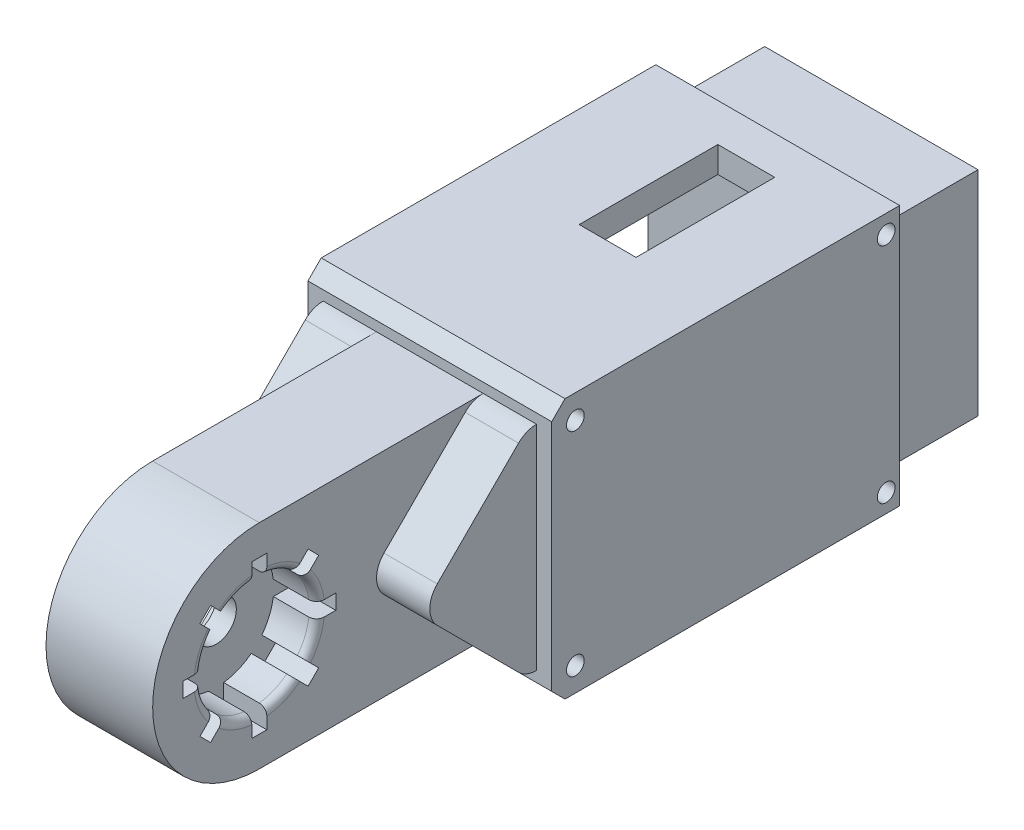
from build123d import *

# Parameters (mm, degrees)
SKETCH2_W                = 42
SKETCH2_H                = 42
BOSS_EXTRUDE1_DEPTH      = 89
SKETCH3_W                = 21
SKETCH3_H                = 42
BOSS_EXTRUDE2_DEPTH      = 42
BOSS_EXTRUDE3_DEPTH      = 21
SKETCH9_R                = 11.35
CUT_EXTRUDE2_DEPTH       = 8.5
CUT_EXTRUDE3_START       = -8.5
SKETCH11_R               = 11.35
CUT_EXTRUDE3_DEPTH       = 8.5
SKETCH12_R               = 3.975
CUT_EXTRUDE4_DEPTH       = 156.157984003
BOSS_EXTRUDE4_DEPTH      = 10.5
BOSS_EXTRUDE4_DEPTH_BACK = 31.5
FILLET1_R                = 5
FILLET2_R                = 5
FILLET3_R                = 5
FILLET4_R                = 5
FILLET5_R                = 5
FILLET6_R                = 5
FILLET7_R                = 1.5
FILLET8_R                = 1.5
SKETCH21_W               = 2.95860585
SKETCH21_H               = 4.417
CUT_EXTRUDE5_DEPTH       = 8.5
CIRPATTERN2_COUNT        = 8
MIRROR1_COPY_1_SKETCH_W  = 2.95860585
MIRROR1_COPY_1_SKETCH_H  = 4.417
MIRROR1_COPY_1_DEPTH     = 8.5
MIRROR1_COPY_2_SKETCH_W  = 2.95860585
MIRROR1_COPY_2_SKETCH_H  = 4.417
MIRROR1_COPY_2_DEPTH     = 8.5
MIRROR1_COPY_3_SKETCH_W  = 2.95860585
MIRROR1_COPY_3_SKETCH_H  = 4.417
MIRROR1_COPY_3_DEPTH     = 8.5
MIRROR1_COPY_4_SKETCH_W  = 2.95860585
MIRROR1_COPY_4_SKETCH_H  = 4.417
MIRROR1_COPY_4_DEPTH     = 8.5
MIRROR1_COPY_5_SKETCH_W  = 2.95860585
MIRROR1_COPY_5_SKETCH_H  = 4.417
MIRROR1_COPY_5_DEPTH     = 8.5
MIRROR1_COPY_6_SKETCH_W  = 2.95860585
MIRROR1_COPY_6_SKETCH_H  = 4.417
MIRROR1_COPY_6_DEPTH     = 8.5
MIRROR1_COPY_7_SKETCH_W  = 2.95860585
MIRROR1_COPY_7_SKETCH_H  = 4.417
MIRROR1_COPY_7_DEPTH     = 8.5
MIRROR1_COPY_8_SKETCH_W  = 2.95860585
MIRROR1_COPY_8_SKETCH_H  = 4.417
MIRROR1_COPY_8_DEPTH     = 8.5
SKETCH24_W               = 86.928932188
SKETCH24_H               = 4.545220174
SKETCH24_H_2             = 4.689106432
BOSS_EXTRUDE6_DEPTH      = 42
SKETCH25_W               = 68.5
SKETCH25_H               = 51.234326606
BOSS_EXTRUDE7_DEPTH      = 3
SKETCH28_W               = 68.5
SKETCH28_H               = 51.234326606
BOSS_EXTRUDE8_DEPTH      = 3
SKETCH30_W               = 62
SKETCH30_H               = 41.004326606
CUT_EXTRUDE6_DEPTH       = 45
SKETCH31_W               = 18.428932188
SKETCH31_H               = 4.615
CUT_EXTRUDE7_DEPTH       = 161.589321529
CHAMFER1_SIZE            = 1.5
SKETCH32_W               = 30
SKETCH32_H               = 30
CUT_EXTRUDE8_DEPTH       = 16.8
SKETCH33_R               = 5
CUT_EXTRUDE9_DEPTH       = 16.8
CUT_EXTRUDE10_DEPTH      = 162.455660134
CHAMFER2_SIZE            = 6
CHAMFER3_SIZE            = 6
CHAMFER4_SIZE            = 6
CHAMFER5_SIZE            = 6
SKETCH35_R               = 1.75
CUT_EXTRUDE11_DEPTH      = 162.455660134
SKETCH38_W               = 11.2
SKETCH38_H               = 27.3
CUT_EXTRUDE12_DEPTH      = 163.188027372


with BuildPart() as part:
    # Sketch2 → Boss-Extrude1 (new body)
    with BuildSketch(Plane.XY):
        Rectangle(SKETCH2_W, SKETCH2_H)
    extrude(amount=BOSS_EXTRUDE1_DEPTH)

    # Sketch3 → Boss-Extrude2 (add)
    with BuildSketch(Plane.XY.offset(89)):
        Rectangle(SKETCH3_W, SKETCH3_H)
    extrude(amount=BOSS_EXTRUDE2_DEPTH)

    # Sketch8 → Boss-Extrude3 (add)
    with BuildSketch(Plane.ZY.offset(10.5)):
        with BuildLine():
            Line((131, 21), (131, -21))
            ThreePointArc((131, -21), (152, 0), (131, 21))
        make_face()
    extrude(amount=-BOSS_EXTRUDE3_DEPTH)

    # Sketch9 → Cut-Extrude2 (cut)
    with BuildSketch(Plane.ZY.offset(10.5)):
        with Locations((131, 0)):
            Circle(SKETCH9_R)
    extrude(amount=-CUT_EXTRUDE2_DEPTH, mode=Mode.SUBTRACT)

    # Sketch11 → Cut-Extrude3 (cut)
    with BuildSketch(Plane(origin=(10.5, 0, 0), x_dir=(0, 0, -1), z_dir=(1, 0, 0)).offset(CUT_EXTRUDE3_START)):
        with Locations((-131, 0)):
            Circle(SKETCH11_R)
    extrude(amount=CUT_EXTRUDE3_DEPTH, mode=Mode.SUBTRACT)

    # Sketch12 → Cut-Extrude4 (cut, through all)
    with BuildSketch(Plane.ZY.offset(2)):
        with Locations((131, 0)):
            Circle(SKETCH12_R)
    extrude(amount=-CUT_EXTRUDE4_DEPTH, mode=Mode.SUBTRACT)

    # Sketch20 → Boss-Extrude4 (add, two sides: drawn at the far end of the back side and taken through both)
    with BuildSketch(Plane.ZY.offset(10.5).offset(-BOSS_EXTRUDE4_DEPTH_BACK)):
        Polygon((89, -21), (110, 0), (89, 21), align=None)
    extrude(amount=BOSS_EXTRUDE4_DEPTH + BOSS_EXTRUDE4_DEPTH_BACK)

    # Fillet1
    fillet1_edges = [part.edges().sort_by_distance(p)[0] for p in [
        (15.75, 0, 110),
    ]]
    fillet(fillet1_edges, radius=FILLET1_R)

    # Fillet2
    fillet2_edges = [part.edges().sort_by_distance(p)[0] for p in [
        (-15.75, 0, 110),
    ]]
    fillet(fillet2_edges, radius=FILLET2_R)

    # Fillet3
    fillet3_edges = [part.edges().sort_by_distance(p)[0] for p in [
        (-15.75, -21, 89),
    ]]
    fillet(fillet3_edges, radius=FILLET3_R)

    # Fillet4
    fillet4_edges = [part.edges().sort_by_distance(p)[0] for p in [
        (-15.75, 21, 89),
    ]]
    fillet(fillet4_edges, radius=FILLET4_R)

    # Fillet5
    fillet5_edges = [part.edges().sort_by_distance(p)[0] for p in [
        (15.75, -21, 89),
    ]]
    fillet(fillet5_edges, radius=FILLET5_R)

    # Fillet6
    fillet6_edges = [part.edges().sort_by_distance(p)[0] for p in [
        (15.75, 21, 89),
    ]]
    fillet(fillet6_edges, radius=FILLET6_R)

    # Fillet7
    fillet7_edges = [part.edges().sort_by_distance(p)[0] for p in [
        (-10.5, 0, 119.65),
    ]]
    fillet(fillet7_edges, radius=FILLET7_R)

    # Fillet8
    fillet8_edges = [part.edges().sort_by_distance(p)[0] for p in [
        (10.5, 0, 142.35),
    ]]
    fillet(fillet8_edges, radius=FILLET8_R)

    # Sketch21 → Cut-Extrude5 (cut)
    with BuildSketch(Plane.ZY.offset(10.5)):
        with Locations((131, 12.85)):
            Rectangle(SKETCH21_W, SKETCH21_H)
    cut_extrude5 = extrude(amount=-CUT_EXTRUDE5_DEPTH, mode=Mode.SUBTRACT)

    # CirPattern2: Cut-Extrude5 ×8 about axis
    cirpattern2_axis = Axis((-9, 0, 131), (-1, 0, 0))
    for i in range(1, CIRPATTERN2_COUNT):
        add(cut_extrude5.rotate(cirpattern2_axis, i * 360 / CIRPATTERN2_COUNT), mode=Mode.SUBTRACT)

    # Mirror1 copy 1 sketch → Mirror1 copy 1 (cut)
    with BuildSketch(Plane(origin=(10.5, -92.630988335, 38.369011665), x_dir=(0, 0.7071067811865475, 0.7071067811865476), z_dir=(1, 0, 0))):
        with Locations((131, -12.85)):
            Rectangle(MIRROR1_COPY_1_SKETCH_W, MIRROR1_COPY_1_SKETCH_H)
    extrude(amount=-MIRROR1_COPY_1_DEPTH, mode=Mode.SUBTRACT)

    # Mirror1 copy 2 sketch → Mirror1 copy 2 (cut)
    with BuildSketch(Plane(origin=(10.5, -131, 131), x_dir=(0, 1, 0), z_dir=(1, 0, 0))):
        with Locations((131, -12.85)):
            Rectangle(MIRROR1_COPY_2_SKETCH_W, MIRROR1_COPY_2_SKETCH_H)
    extrude(amount=-MIRROR1_COPY_2_DEPTH, mode=Mode.SUBTRACT)

    # Mirror1 copy 3 sketch → Mirror1 copy 3 (cut)
    with BuildSketch(Plane(origin=(10.5, -92.630988335, 223.630988335), x_dir=(0, 0.7071067811865476, -0.7071067811865475), z_dir=(1, 0, 0))):
        with Locations((131, -12.85)):
            Rectangle(MIRROR1_COPY_3_SKETCH_W, MIRROR1_COPY_3_SKETCH_H)
    extrude(amount=-MIRROR1_COPY_3_DEPTH, mode=Mode.SUBTRACT)

    # Mirror1 copy 4 sketch → Mirror1 copy 4 (cut)
    with BuildSketch(Plane(origin=(10.5, 0, 262), x_dir=(0, 0, -1), z_dir=(1, 0, 0))):
        with Locations((131, -12.85)):
            Rectangle(MIRROR1_COPY_4_SKETCH_W, MIRROR1_COPY_4_SKETCH_H)
    extrude(amount=-MIRROR1_COPY_4_DEPTH, mode=Mode.SUBTRACT)

    # Mirror1 copy 5 sketch → Mirror1 copy 5 (cut)
    with BuildSketch(Plane(origin=(10.5, 92.630988335, 223.630988335), x_dir=(0, -0.7071067811865475, -0.7071067811865477), z_dir=(1, 0, 0))):
        with Locations((131, -12.85)):
            Rectangle(MIRROR1_COPY_5_SKETCH_W, MIRROR1_COPY_5_SKETCH_H)
    extrude(amount=-MIRROR1_COPY_5_DEPTH, mode=Mode.SUBTRACT)

    # Mirror1 copy 6 sketch → Mirror1 copy 6 (cut)
    with BuildSketch(Plane(origin=(10.5, 131, 131), x_dir=(0, -1, 0), z_dir=(1, 0, 0))):
        with Locations((131, -12.85)):
            Rectangle(MIRROR1_COPY_6_SKETCH_W, MIRROR1_COPY_6_SKETCH_H)
    extrude(amount=-MIRROR1_COPY_6_DEPTH, mode=Mode.SUBTRACT)

    # Mirror1 copy 7 sketch → Mirror1 copy 7 (cut)
    with BuildSketch(Plane(origin=(10.5, 92.630988335, 38.369011665), x_dir=(0, -0.7071067811865477, 0.7071067811865474), z_dir=(1, 0, 0))):
        with Locations((131, -12.85)):
            Rectangle(MIRROR1_COPY_7_SKETCH_W, MIRROR1_COPY_7_SKETCH_H)
    extrude(amount=-MIRROR1_COPY_7_DEPTH, mode=Mode.SUBTRACT)

    # Mirror1 copy 8 sketch → Mirror1 copy 8 (cut)
    with BuildSketch(Plane(origin=(10.5, 0, 0), x_dir=(0, 0, 1), z_dir=(1, 0, 0))):
        with Locations((131, -12.85)):
            Rectangle(MIRROR1_COPY_8_SKETCH_W, MIRROR1_COPY_8_SKETCH_H)
    extrude(amount=-MIRROR1_COPY_8_DEPTH, mode=Mode.SUBTRACT)

    # Sketch24 → Boss-Extrude6 (add)
    with BuildSketch(Plane(origin=(21, 0, 0), x_dir=(0, 0, -1), z_dir=(1, 0, 0))):
        with Locations((-43.464466094, 23.272610087)):
            Rectangle(SKETCH24_W, SKETCH24_H)
        with Locations((-43.464466094, -23.344553216)):
            Rectangle(SKETCH24_W, SKETCH24_H_2)
    extrude(amount=-BOSS_EXTRUDE6_DEPTH)

    # Sketch25 → Boss-Extrude7 (add)
    with BuildSketch(Plane(origin=(21, 0, 0), x_dir=(0, 0, -1), z_dir=(1, 0, 0))):
        with Locations((-52.678932188, -0.071943129)):
            Rectangle(SKETCH25_W, SKETCH25_H)
    extrude(amount=BOSS_EXTRUDE7_DEPTH)

    # Sketch28 → Boss-Extrude8 (add)
    with BuildSketch(Plane.ZY.offset(21)):
        with Locations((52.678932188, -0.071943129)):
            Rectangle(SKETCH28_W, SKETCH28_H)
    extrude(amount=BOSS_EXTRUDE8_DEPTH)

    # Sketch30 → Cut-Extrude6 (cut)
    with BuildSketch(Plane.ZY.offset(24)):
        with Locations((50.928932188, -0.071943129)):
            Rectangle(SKETCH30_W, SKETCH30_H)
    extrude(amount=-CUT_EXTRUDE6_DEPTH, mode=Mode.SUBTRACT)

    # Sketch31 → Cut-Extrude7 (cut, through all)
    with BuildSketch(Plane(origin=(21, 0, 0), x_dir=(0, 0, -1), z_dir=(1, 0, 0))):
        with Locations((-9.214466094, -23.381606432)):
            Rectangle(SKETCH31_W, SKETCH31_H)
        with Locations((-9.214466094, 23.237720174)):
            Rectangle(SKETCH31_W, SKETCH31_H)
    extrude(amount=-CUT_EXTRUDE7_DEPTH, mode=Mode.SUBTRACT)

    # Chamfer1
    chamfer1_edges = [part.edges().sort_by_distance(p)[0] for p in [
        (0, 20.930220174, 18.428932188),
        (21, -0.071943129, 18.428932188),
        (0, -21.074106432, 18.428932188),
        (-21, -0.071943129, 18.428932188),
    ]]
    chamfer(chamfer1_edges, length=CHAMFER1_SIZE)

    # Sketch32 → Cut-Extrude8 (cut)
    with BuildSketch(Plane(origin=(0, 0, 0), x_dir=(-1, 0, 0), z_dir=(0, 0, -1))):
        Rectangle(SKETCH32_W, SKETCH32_H)
    extrude(amount=-CUT_EXTRUDE8_DEPTH, mode=Mode.SUBTRACT)

    # Sketch33 → Cut-Extrude9 (cut)
    with BuildSketch(Plane.XY.offset(19.928932188)):
        Circle(SKETCH33_R)
    extrude(amount=-CUT_EXTRUDE9_DEPTH, mode=Mode.SUBTRACT)

    # Sketch34 → Cut-Extrude10 (cut, through all)
    with BuildSketch(Plane.ZY.offset(24)):
        Polygon((88.330412389, -21.669587611), (88.330412389, -28.222069099), (81.777930901, -28.222069099), align=None)
        Polygon((88.330412389, 28.078182842), (81.777930901, 28.078182842), (88.330412389, 21.525701354), align=None)
    extrude(amount=-CUT_EXTRUDE10_DEPTH, mode=Mode.SUBTRACT)

    # Chamfer2
    chamfer2_edges = [part.edges().sort_by_distance(p)[0] for p in [
        (-1.5, 20.430220174, 81.928932188),
    ]]
    chamfer(chamfer2_edges, length=CHAMFER2_SIZE)

    # Chamfer3
    chamfer3_edges = [part.edges().sort_by_distance(p)[0] for p in [
        (-1.5, -20.574106432, 81.928932188),
    ]]
    chamfer(chamfer3_edges, length=CHAMFER3_SIZE)

    # Chamfer4
    chamfer4_edges = [part.edges().sort_by_distance(p)[0] for p in [
        (-1.5, 20.430220174, 19.928932188),
    ]]
    chamfer(chamfer4_edges, length=CHAMFER4_SIZE)

    # Chamfer5
    chamfer5_edges = [part.edges().sort_by_distance(p)[0] for p in [
        (-1.5, -20.574106432, 19.928932188),
    ]]
    chamfer(chamfer5_edges, length=CHAMFER5_SIZE)

    # Sketch35 → Cut-Extrude11 (cut, through all)
    with BuildSketch(Plane.ZY.offset(24)):
        with Locations((21.074129387, 21.904762541)):
            Circle(SKETCH35_R)
        with Locations((82.274422533, 20.83321052)):
            Circle(SKETCH35_R)
        with Locations((82.274422533, -20.977096777)):
            Circle(SKETCH35_R)
        with Locations((21.073965823, -22.048529957)):
            Circle(SKETCH35_R)
    extrude(amount=-CUT_EXTRUDE11_DEPTH, mode=Mode.SUBTRACT)

    # Sketch38 → Cut-Extrude12 (cut, through all)
    with BuildSketch(Plane(origin=(0, -25.689106432, 0), x_dir=(-1, 0, 0), z_dir=(0, -1, 0))):
        with Locations((-1.30782555, -39.578932188)):
            Rectangle(SKETCH38_W, SKETCH38_H)
    extrude(amount=-CUT_EXTRUDE12_DEPTH, mode=Mode.SUBTRACT)


solid = part.part
